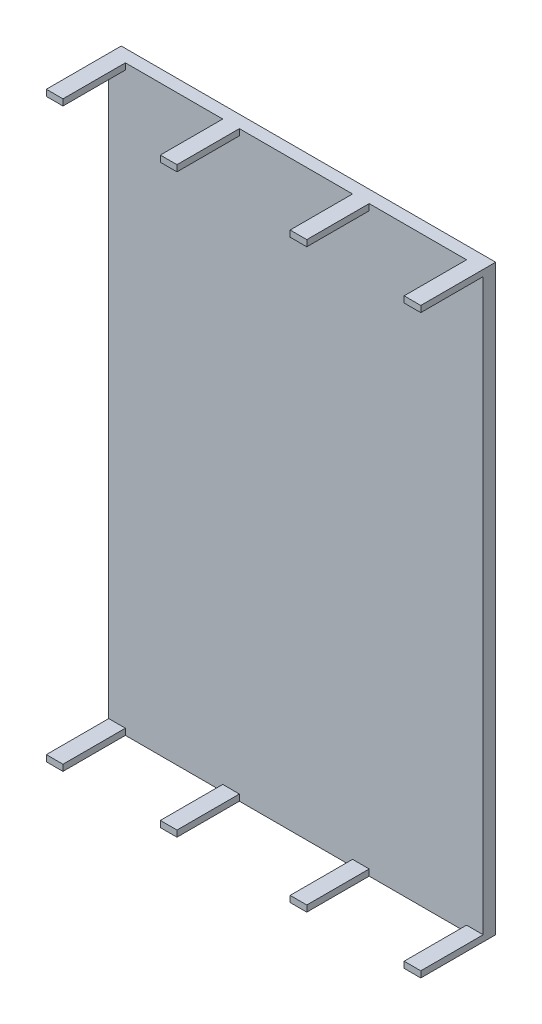
from build123d import *

# Parameters (mm, degrees)
SKETCH1_W           = 140
SKETCH1_H           = 90
BOSS_EXTRUDE1_DEPTH = 3
SKETCH2_W           = 4
SKETCH2_H           = 1.5
BOSS_EXTRUDE2_DEPTH = 15


with BuildPart() as part:
    # Sketch1 → Boss-Extrude1 (new body)
    with BuildSketch(Plane(origin=(0, 0, 0), x_dir=(0, 1, 0), z_dir=(0, 0, 1))):
        with Locations((-70, 45)):
            Rectangle(SKETCH1_W, SKETCH1_H)
    extrude(amount=BOSS_EXTRUDE1_DEPTH)

    # Sketch2 → Boss-Extrude2 (add)
    with BuildSketch(Plane.XY.offset(3)):
        with Locations((-88, -0.75)):
            Rectangle(SKETCH2_W, SKETCH2_H)
        with Locations((-60.6, -0.75)):
            Rectangle(SKETCH2_W, SKETCH2_H)
        with Locations((-88, -139.25)):
            Rectangle(SKETCH2_W, SKETCH2_H)
        with Locations((-29.4, -0.75)):
            Rectangle(SKETCH2_W, SKETCH2_H)
        with Locations((-60.6, -139.25)):
            Rectangle(SKETCH2_W, SKETCH2_H)
        with Locations((-2, -0.75)):
            Rectangle(SKETCH2_W, SKETCH2_H)
        with Locations((-29.4, -139.25)):
            Rectangle(SKETCH2_W, SKETCH2_H)
        with Locations((-2, -139.25)):
            Rectangle(SKETCH2_W, SKETCH2_H)
    extrude(amount=BOSS_EXTRUDE2_DEPTH)


solid = part.part
